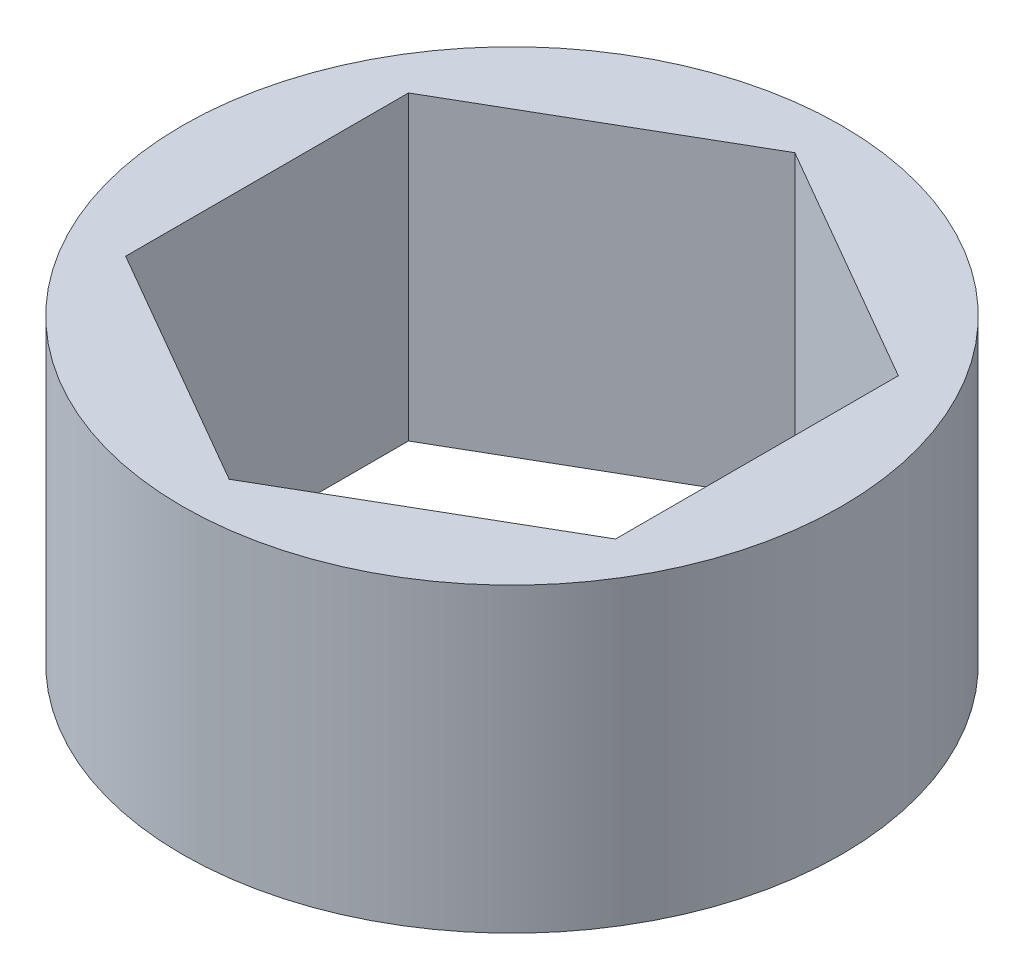
from build123d import *

# Parameters (mm, degrees)
SKETCH1_R           = 8.89
BOSS_EXTRUDE1_DEPTH = 4.064


with BuildPart() as part:
    # Sketch1 → Boss-Extrude1 (new, symmetric)
    with BuildSketch(Plane(origin=(0, 0, 0), x_dir=(1, 0, 0), z_dir=(0, 1, 0))):
        Circle(SKETCH1_R)
        Polygon((0, 7.625642355), (-6.604, 3.812821178), (-6.604, -3.812821178), (0, -7.625642355), (6.604, -3.812821178), (6.604, 3.812821178), align=None, mode=Mode.SUBTRACT)
    extrude(amount=BOSS_EXTRUDE1_DEPTH, both=True)


solid = part.part
